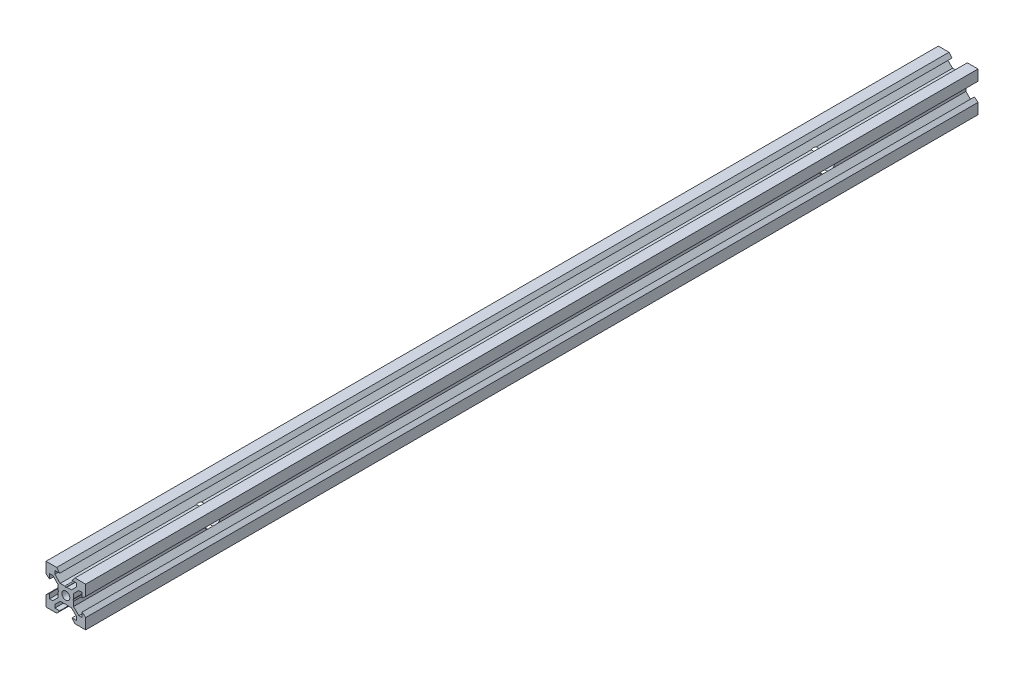
from build123d import *

# Parameters (mm, degrees)
SKETCH1_R           = 2
BOSS_EXTRUDE1_DEPTH = 450
SKETCH2_R           = 4.1
CUT_EXTRUDE1_DEPTH  = 451.325671043


with BuildPart() as part:
    # Sketch1 → Boss-Extrude1 (new body)
    with BuildSketch(Plane.XY):
        Polygon((10, 4.610379336), (10, 10), (4.610379336, 10), (3.1, 8.2), (5.5, 8.2), (5.5, 6.560660172), (2.839339828, 3.9), (0.519615242, 3.9), (0, 3.6), (-0.519615242, 3.9), (-2.839339828, 3.9), (-5.5, 6.560660172), (-5.5, 8.2), (-3.1, 8.2), (-4.610379336, 10), (-10, 10), (-10, 4.610379336), (-8.2, 3.1), (-8.2, 5.5), (-6.560660172, 5.5), (-3.9, 2.839339828), (-3.9, 0.519615242), (-3.6, 0), (-3.9, -0.519615242), (-3.9, -2.839339828), (-6.560660172, -5.5), (-8.2, -5.5), (-8.2, -3.1), (-10, -4.610379336), (-10, -10), (-4.610379336, -10), (-3.1, -8.2), (-5.5, -8.2), (-5.5, -6.560660172), (-2.839339828, -3.9), (-0.519615242, -3.9), (0, -3.6), (0.519615242, -3.9), (2.839339828, -3.9), (5.5, -6.560660172), (5.5, -8.2), (3.1, -8.2), (4.610379336, -10), (10, -10), (10, -4.610379336), (8.2, -3.1), (8.2, -5.5), (6.560660172, -5.5), (3.9, -2.839339828), (3.9, -0.519615242), (3.6, 0), (3.9, 0.519615242), (3.9, 2.839339828), (6.560660172, 5.5), (8.2, 5.5), (8.2, 3.1), align=None)
        Circle(SKETCH1_R, mode=Mode.SUBTRACT)
    extrude(amount=BOSS_EXTRUDE1_DEPTH)

    # Sketch2 → Cut-Extrude1 (cut, through all)
    with BuildSketch(Plane(origin=(3.9, 0, 0), x_dir=(0, 0, -1), z_dir=(1, 0, 0))):
        with Locations((-380, 0)):
            Circle(SKETCH2_R)
        with Locations((-70, 0)):
            Circle(SKETCH2_R)
    extrude(amount=-CUT_EXTRUDE1_DEPTH, mode=Mode.SUBTRACT)


solid = part.part
